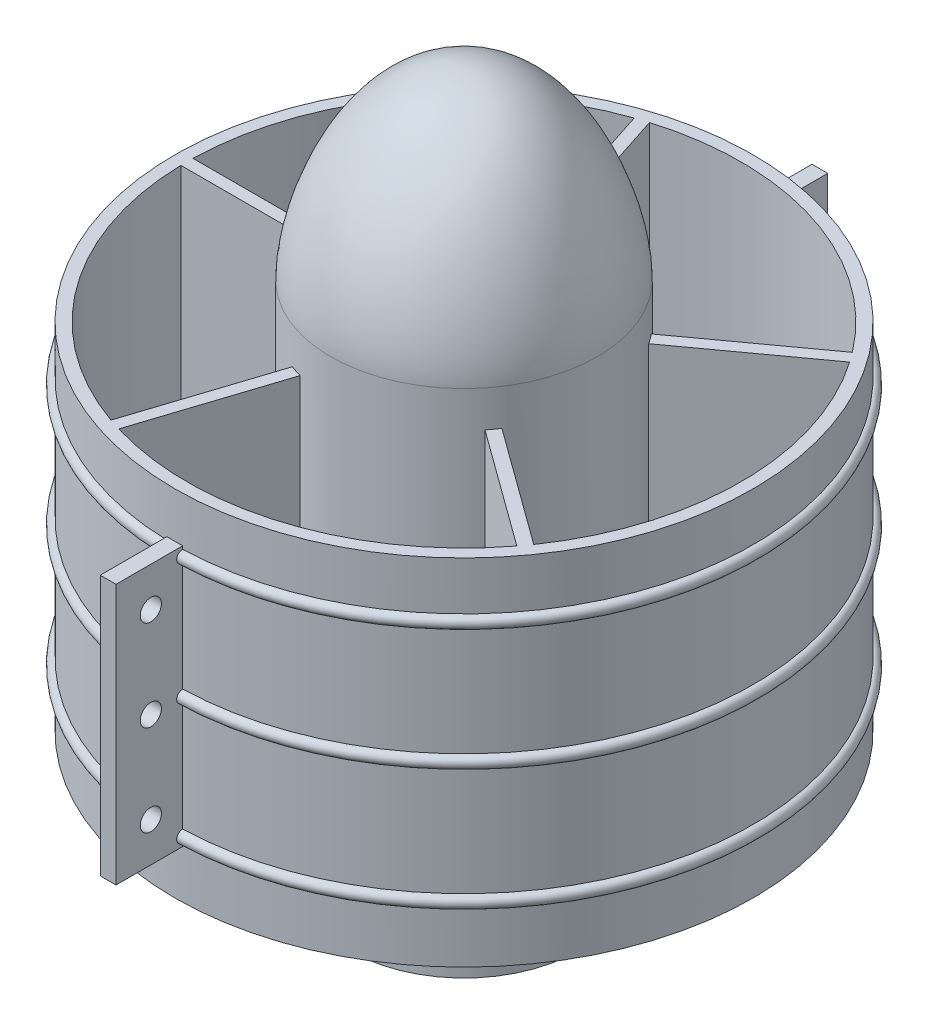
from build123d import *
from build123d.topology import SkipClean

# Parameters (mm, degrees)
SKETCH1_R                = 18.85
BOSS_EXTRUDE1_DEPTH      = 12
SKETCH2_R                = 22
BOSS_EXTRUDE2_DEPTH      = 10
SKETCH3_R                = 47.75
BOSS_EXTRUDE3_DEPTH      = 58.5
BOSS_EXTRUDE5_DEPTH      = 1.3
BOSS_EXTRUDE5_DEPTH_BACK = 1.3
SKETCH6_W                = 12
SKETCH6_H                = 43
SKETCH6_R                = 1.75


with BuildPart() as part:
    # Sketch1 → Boss-Extrude1 (new body)
    with BuildSketch(Plane(origin=(0, 0, 0), x_dir=(1, 0, 0), z_dir=(0, 1, 0))):
        with Locations(Location((0, 0, 0), (0, 0, 270))):
            Circle(SKETCH1_R)
    extrude(amount=BOSS_EXTRUDE1_DEPTH)

    # Sketch2 → Boss-Extrude2 (add)
    with BuildSketch(Plane(origin=(0, 12, 0), x_dir=(1, 0, 0), z_dir=(0, 1, 0))):
        with Locations(Location((0, 0, 0), (0, 0, 270))):
            Circle(SKETCH2_R)
    extrude(amount=BOSS_EXTRUDE2_DEPTH)

    # Sketch3 → Boss-Extrude3 (add)
    with SkipClean():  # the faces are left unmerged after this step: merging them gives an invalid solid
        with BuildSketch(Plane(origin=(0, 22, 0), x_dir=(1, 0, 0), z_dir=(0, 1, 0))):
            with Locations(Location((0, 0, 0), (0, 0, 270))):
                Circle(SKETCH3_R)
            with BuildLine():
                Line((-13.183093338, 43.809457313), (-5.840290615, 21.210634256))
                ThreePointArc((-5.840290615, 21.210634256), (6.798373876, 20.923243358), (17.192192367, 13.726926882))
                Line((17.192192367, 13.726926882), (36.415899468, 27.693767637))
                ThreePointArc((36.415899468, 27.693767637), (14.137527493, 43.510835621), (-13.183093338, 43.809457313))
            make_face(mode=Mode.SUBTRACT)
            with BuildLine():
                Line((-45.739069733, 1), (-21.977260976, 1))
                ThreePointArc((-21.977260976, 1), (-17.798373876, 12.93127555), (-7.742403648, 20.592600267))
                Line((-7.742403648, 20.592600267), (-15.085206371, 43.191423324))
                ThreePointArc((-15.085206371, 43.191423324), (-37.012527493, 26.891175292), (-45.739069733, 1))
            make_face(mode=Mode.SUBTRACT)
            with BuildLine():
                Line((-45.739069733, -1), (-21.977260976, -1))
                ThreePointArc((-21.977260976, -1), (-17.798373876, -12.93127555), (-7.742403648, -20.592600267))
                Line((-7.742403648, -20.592600267), (-15.085206371, -43.191423324))
                ThreePointArc((-15.085206371, -43.191423324), (-37.012527493, -26.891175292), (-45.739069733, -1))
            make_face(mode=Mode.SUBTRACT)
            with BuildLine():
                Line((37.591469973, 26.075733648), (18.367762872, 12.108892893))
                ThreePointArc((18.367762872, 12.108892893), (22, 0), (18.367762872, -12.108892893))
                Line((18.367762872, -12.108892893), (37.591469973, -26.075733648))
                ThreePointArc((37.591469973, -26.075733648), (45.75, 0), (37.591469973, 26.075733648))
            make_face(mode=Mode.SUBTRACT)
            with BuildLine():
                Line((36.415899468, -27.693767637), (17.192192367, -13.726926882))
                ThreePointArc((17.192192367, -13.726926882), (6.798373876, -20.923243358), (-5.840290615, -21.210634256))
                Line((-5.840290615, -21.210634256), (-13.183093338, -43.809457313))
                ThreePointArc((-13.183093338, -43.809457313), (14.137527493, -43.510835621), (36.415899468, -27.693767637))
            make_face(mode=Mode.SUBTRACT)
        extrude(amount=BOSS_EXTRUDE3_DEPTH)

    # Revolve1: read off the stored shape, not the designer's step
    # Revolve1 outline → Revolve1 (revolve)
    with SkipClean():  # the faces are left unmerged after this step: merging them gives an invalid solid
        with BuildSketch(Plane.XY):
            with BuildLine():
                ThreePointArc((47.75, 70.5), (48.75, 71.5), (47.75, 72.5))
                Line((47.75, 72.5), (47.75, 70.5))
            make_face()
            with BuildLine():
                ThreePointArc((47.75, 50.5), (48.75, 51.5), (47.75, 52.5))
                Line((47.75, 52.5), (47.75, 50.5))
            make_face()
            with BuildLine():
                ThreePointArc((47.75, 30.5), (48.75, 31.5), (47.75, 32.5))
                Line((47.75, 32.5), (47.75, 30.5))
            make_face()
        revolve(axis=Axis((0, 0, 0), (0, 1, 0)))

    # Revolve1 2 outline → Revolve1 2 (revolve)
    with SkipClean():  # the faces are left unmerged after this step: merging them gives an invalid solid
        with BuildSketch(Plane.XY):
            with BuildLine():
                add(Edge.make_bspline(
                    [(0, 116.5), (14.666666667, 116.5), (22, 95.787444652), (22, 86.5)],
                    knots=[0, 0, 0, 0, 1, 1, 1, 1], degree=3))
                Line((0, 116.5), (0, 80.5))
                Line((0, 80.5), (22.0000001, 80.5))
                Line((22.0000001, 80.5), (22, 86.5))
            make_face()
        revolve(axis=Axis((0, 0, 0), (0, 1, 0)))

    # Sketch6 → Boss-Extrude5 (add, two sides: drawn at the far end of the back side and taken through both)
    # profile 1 of 2: a face of its own
    with SkipClean():  # the faces are left unmerged after this step: merging them gives an invalid solid
        with BuildSketch(Plane(origin=(0, 0, 0), x_dir=(0, 0, -1), z_dir=(1, 0, 0)).offset(-BOSS_EXTRUDE5_DEPTH_BACK)):
            with Locations((-52.75, 51.5)):
                Rectangle(SKETCH6_W, SKETCH6_H)
            with Locations((-53, 51.5)):
                Circle(SKETCH6_R, mode=Mode.SUBTRACT)
            with Locations((-53, 66.5)):
                Circle(SKETCH6_R, mode=Mode.SUBTRACT)
            with Locations((-53, 36.5)):
                Circle(SKETCH6_R, mode=Mode.SUBTRACT)
        # profile 2 of 2: a face of its own
        with BuildSketch(Plane(origin=(0, 0, 0), x_dir=(0, 0, -1), z_dir=(1, 0, 0)).offset(-BOSS_EXTRUDE5_DEPTH_BACK)):
            with Locations((52.75, 51.5)):
                Rectangle(SKETCH6_W, SKETCH6_H)
            with Locations(Location((53, 51.5, 0), (0, 0, 180))):
                Circle(SKETCH6_R, mode=Mode.SUBTRACT)
            with Locations(Location((53, 36.5, 0), (0, 0, 180))):
                Circle(SKETCH6_R, mode=Mode.SUBTRACT)
            with Locations(Location((53, 66.5, 0), (0, 0, 180))):
                Circle(SKETCH6_R, mode=Mode.SUBTRACT)
        extrude(amount=BOSS_EXTRUDE5_DEPTH + BOSS_EXTRUDE5_DEPTH_BACK)


solid = part.part
